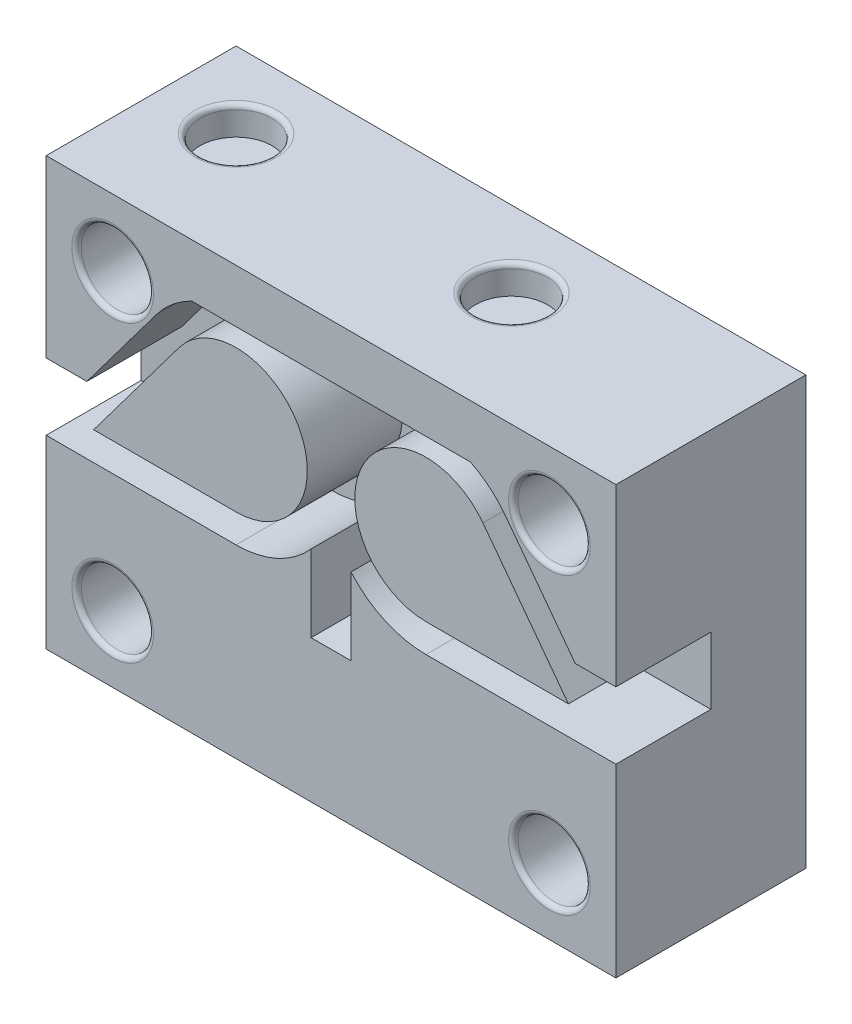
from build123d import *

# Parameters (mm, degrees)
SKETCH1_R             = 3.8
BOSS_EXTRUDE1_DEPTH   = 20
BOSS_EXTRUDE1_2_DEPTH = 20
BOSS_EXTRUDE1_3_DEPTH = 20
BOSS_EXTRUDE1_4_DEPTH = 20
BOSS_EXTRUDE2_DEPTH   = 10
FILLET1_R             = 0.5
SKETCH2_R             = 3.8
CUT_EXTRUDE1_DEPTH    = 3
FILLET2_R             = 0.5


with BuildPart() as part:
    # Sketch1 → Boss-Extrude1 (new body)
    with BuildSketch(Plane.XY):
        with BuildLine():
            Line((-30, -3), (-30, -22.5))
            Line((-30, -22.5), (30, -22.5))
            Line((30, -22.5), (30, -3))
            Line((30, -3), (10, -3))
            ThreePointArc((10, -3), (5.663072607, -2.062481937), (2.100611456, 0.582655088))
            Line((2.100611456, 0.582655088), (2.100327913, -7.512763105))
            Line((2.100327913, -7.512763105), (-2.100611456, -7.512763105))
            Line((-2.100611456, -7.512763105), (-2.100611456, 0.582655088))
            ThreePointArc((-2.100611456, 0.582655088), (-5.663072607, -2.062481937), (-10, -3))
            Line((-10, -3), (-30, -3))
        make_face()
        with Locations((-23, -15.5)):
            Circle(SKETCH1_R, mode=Mode.SUBTRACT)
        with Locations((23, -15.5)):
            Circle(SKETCH1_R, mode=Mode.SUBTRACT)
    extrude(amount=BOSS_EXTRUDE1_DEPTH)



with BuildPart() as body_2:
    # Sketch1 → Boss-Extrude1 2 (new body)
    with BuildSketch(Plane.XY):
        with BuildLine():
            Line((-30, 22.5), (-30, 4.047627556))
            Line((-30, 4.047627556), (-25.714279333, 4.047627556))
            Line((-25.714279333, 4.047627556), (-18.4, 13.8))
            ThreePointArc((-18.4, 13.8), (-16.720396487, 15.567606278), (-14.678379216, 16.900147228))
            Line((-14.678379216, 16.900147228), (14.678379216, 16.900147228))
            ThreePointArc((14.678379216, 16.900147228), (16.720396487, 15.567606278), (18.4, 13.8))
            Line((18.4, 13.8), (25.714279333, 4.047627556))
            Line((25.714279333, 4.047627556), (30, 4.047627556))
            Line((30, 4.047627556), (30, 22.5))
            Line((30, 22.5), (-30, 22.5))
        make_face()
        with Locations((-23, 15.5)):
            Circle(SKETCH1_R, mode=Mode.SUBTRACT)
        with Locations((23, 15.5)):
            Circle(SKETCH1_R, mode=Mode.SUBTRACT)
    extrude(amount=BOSS_EXTRUDE1_2_DEPTH)


with BuildPart() as body_3:
    # Sketch1 → Boss-Extrude1 3 (new body)
    with BuildSketch(Plane.XY):
        with BuildLine():
            Line((-25, 0), (-10, 0))
            ThreePointArc((-10, 0), (-3.291796068, 10.854101966), (-16, 12))
            Line((-16, 12), (-25, 0))
        make_face()
    extrude(amount=BOSS_EXTRUDE1_3_DEPTH)


with BuildPart() as body_4:
    # Sketch1 → Boss-Extrude1 4 (new body)
    with BuildSketch(Plane.XY):
        with BuildLine():
            Line((10, 0), (25, 0))
            Line((25, 0), (16, 12))
            ThreePointArc((16, 12), (3.291796068, 10.854101966), (10, 0))
        make_face()
    extrude(amount=BOSS_EXTRUDE1_4_DEPTH)


with BuildPart() as part_1:
    add(part.part)

    add(body_2.part)  # Boss-Extrude2 merges body 2
    # Sketch1<6> → Boss-Extrude2 (add)
    with BuildSketch(Plane.XY):
        with BuildLine():
            Line((-30, 4.047627556), (-30, -3))
            Line((-30, -3), (-10, -3))
            ThreePointArc((-10, -3), (-5.663072607, -2.062481937), (-2.100611456, 0.582655088))
            Line((-2.100611456, 0.582655088), (-2.100611456, -7.512763105))
            Line((-2.100611456, -7.512763105), (2.100327913, -7.512763105))
            Line((2.100327913, -7.512763105), (2.100611456, 0.582655088))
            ThreePointArc((2.100611456, 0.582655088), (5.663072607, -2.062481937), (10, -3))
            Line((10, -3), (30, -3))
            Line((30, -3), (30, 4.047627556))
            Line((30, 4.047627556), (25.714279333, 4.047627556))
            Line((25.714279333, 4.047627556), (18.4, 13.8))
            ThreePointArc((18.4, 13.8), (16.720396487, 15.567606278), (14.678379216, 16.900147228))
            Line((14.678379216, 16.900147228), (-14.678379216, 16.900147228))
            ThreePointArc((-14.678379216, 16.900147228), (-16.720396487, 15.567606278), (-18.4, 13.8))
            Line((-18.4, 13.8), (-25.714279333, 4.047627556))
            Line((-25.714279333, 4.047627556), (-30, 4.047627556))
        make_face()
        with BuildLine():
            ThreePointArc((-2.5, 7.5), (-4.696699141, 2.196699141), (-10, 0))
            Line((-10, 0), (-25, 0))
            Line((-25, 0), (-16, 12))
            ThreePointArc((-16, 12), (-7.628291755, 14.615124735), (-2.5, 7.5))
        make_face(mode=Mode.SUBTRACT)
        with BuildLine():
            Line((16, 12), (25, 0))
            Line((25, 0), (10, 0))
            ThreePointArc((10, 0), (3.291796068, 10.854101966), (16, 12))
        make_face(mode=Mode.SUBTRACT)
    extrude(amount=BOSS_EXTRUDE2_DEPTH)

    # Fillet1
    fillet1_edges = [part_1.edges().sort_by_distance(p)[0] for p in [
        (-26.8, -15.5, 0),
        (19.2, -15.5, 0),
        (19.2, 15.5, 0),
        (-26.8, 15.5, 0),
        (19.2, -15.5, 20),
        (19.2, 15.5, 20),
        (-26.8, -15.5, 20),
        (-26.8, 15.5, 20),
    ]]
    fillet(fillet1_edges, radius=FILLET1_R)

    # Sketch2 → Cut-Extrude1 (cut)
    with BuildSketch(Plane(origin=(0, 22.5, 0), x_dir=(1, 0, 0), z_dir=(0, 1, 0))):
        with Locations((-22, -8)):
            Circle(SKETCH2_R)
        with Locations((7, -8)):
            Circle(SKETCH2_R)
    extrude(amount=-CUT_EXTRUDE1_DEPTH, mode=Mode.SUBTRACT)

    # Fillet2
    fillet2_edges = [part_1.edges().sort_by_distance(p)[0] for p in [
        (3.2, 22.5, 8),
        (-25.8, 22.5, 8),
    ]]
    fillet(fillet2_edges, radius=FILLET2_R)


solid = Compound([body_3.part, body_4.part, part_1.part])
